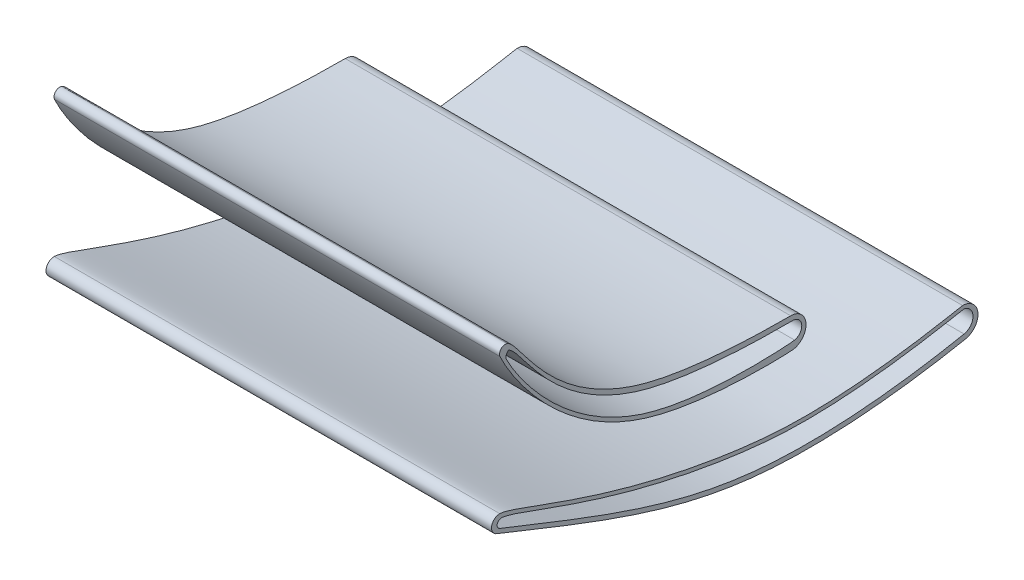
from build123d import *

# Parameters (mm, degrees)
BOSS_EXTRUDE1_DEPTH = 10
BOSS_EXTRUDE3_DEPTH = 500
SPLIT1_DEPTH        = 10
CUT_EXTRUDE4_DEPTH  = 815.609824939


# Read off the part's stored shape, not the designer's step: Split1
with BuildPart() as part:
    # Sketch1 → Boss-Extrude1 (new body)
    with BuildSketch(Plane(origin=(0, 0, 0), x_dir=(0, 0, -1), z_dir=(1, 0, 0))):
        with BuildLine():
            Line((0, -14.281480067), (0, -294.281480067))
            ThreePointArc((0, -294.281480067), (8.786796564, -315.494683503), (30, -324.281480067))
            Line((30, -324.281480067), (573.815572472, -324.281480067))
            ThreePointArc((573.815572472, -324.281480067), (580.886640283, -321.352547879), (583.815572472, -314.281480067))
            Line((583.815572472, -314.281480067), (583.815572472, -219.493566063))
            ThreePointArc((583.815572472, -219.493566063), (582.007092914, -213.757801699), (577.235773905, -210.096639855))
            Line((577.235773905, -210.096639855), (13.420201433, -4.88455386))
            ThreePointArc((13.420201433, -4.88455386), (4.264235636, -6.089959625), (0, -14.281480067))
        make_face()
    extrude(amount=BOSS_EXTRUDE1_DEPTH)

    # Sketch2 → Boss-Extrude3 (add)
    with BuildSketch(Plane(origin=(10, 0, 0), x_dir=(0, 0, -1), z_dir=(1, 0, 0))):
        with BuildLine():
            ThreePointArc((23.162175785, -218.017297737), (17.576945532, -207.678107035), (26.738120061, -200.318314743))
            add(Edge.make_bspline(
                [(26.738120061, -200.318314743), (45.914354434, -200.660753587), (151.32107334, -255.510398156), (414.880335601, -286.385074175), (542.431128002, -257.731725159), (546.154906269, -257.731029979)],
                knots=[0, 0, 0, 0, 0.560935224, 0.660935224, 1, 1, 1, 1], degree=3))
            ThreePointArc((546.154906269, -257.731029979), (563.288388976, -273.27487263), (549.474047026, -291.831036849))
            add(Edge.make_bspline(
                [(23.162175785, -218.017297737), (143.080818041, -266.034178467), (284.669923623, -324.572171749), (474.750080899, -306.502271197), (549.474047026, -291.831036849)],
                knots=[0, 0, 0, 0, 0.576111686, 1, 1, 1, 1], degree=3))
        make_face()
        with BuildLine():
            ThreePointArc((26.950185671, -47.737214996), (28.17113687, -40.715672082), (35.124917897, -39.154353359))
            add(Edge.make_bspline(
                [(35.124917897, -39.154353359), (50.602952828, -45.122445935), (99.042539, -170.661871263), (331.224003862, -171.181746235), (353.169530365, -171.181734297)],
                knots=[0, 0, 0, 0, 0.639195597, 1, 1, 1, 1], degree=3))
            ThreePointArc((353.169530365, -171.181734297), (370.309371751, -186.812434708), (356.32010769, -205.316311305))
            add(Edge.make_bspline(
                [(26.950185671, -47.737214996), (35.312726243, -66.629555086), (121.396454164, -217.989087479), (352.838937223, -205.964445921), (356.32010769, -205.316311305)],
                knots=[0, 0, 0, 0, 0.59031533, 1, 1, 1, 1], degree=3))
        make_face()
    extrude(amount=BOSS_EXTRUDE3_DEPTH)

    # Split1 outline → Split1 (cut)
    with BuildSketch(Plane.YZ):
        with BuildLine():
            ThreePointArc((-294.281480067, 0), (-315.494683503, -8.786796564), (-324.281480067, -30))
            Line((-324.281480067, -30), (-324.281480067, -573.815572472))
            ThreePointArc((-324.281480067, -573.815572472), (-321.352547879, -580.886640284), (-314.281480067, -583.815572472))
            Line((-314.281480067, -583.815572472), (-219.493566063, -583.815572472))
            ThreePointArc((-219.493566063, -583.815572472), (-213.7578017, -582.007092914), (-210.096639855, -577.235773905))
            Line((-210.096639855, -577.235773905), (-4.88455386, -13.420201433))
            ThreePointArc((-4.88455386, -13.420201433), (-6.089959625, -4.264235637), (-14.281480067, 0))
            Line((-14.281480067, 0), (-294.281480067, 0))
        make_face()
    extrude(amount=SPLIT1_DEPTH, mode=Mode.SUBTRACT)

    # Sketch4 → Cut-Extrude4 (cut, through all)
    with BuildSketch(Plane(origin=(510, 0, 0), x_dir=(0, 0, -1), z_dir=(1, 0, 0))):
        with BuildLine():
            ThreePointArc((36.563368255, -46.349264869), (33.864766991, -49.821146991), (34.206527229, -54.205165034))
            add(Edge.make_bspline(
                [(34.206527229, -54.205165034), (42.853728256, -72.241323292), (130.60126666, -216.180799122), (354.210920858, -197.746703186), (357.560551344, -197.017263718)],
                knots=[0, 0, 0, 0, 0.59031533, 1, 1, 1, 1], degree=3))
            ThreePointArc((357.560551344, -197.017263718), (365.49715028, -185.900768208), (355.211383297, -176.91360666))
            add(Edge.make_bspline(
                [(355.211383297, -176.91360666), (333.266088603, -177.014474156), (101.084686466, -177.561646331), (52.068667432, -52.246161661), (36.563368255, -46.349264869)],
                knots=[0, 0, 0, 0, 0.360804403, 1, 1, 1, 1], degree=3))
        make_face()
        with BuildLine():
            ThreePointArc((28.631678276, -205.319570052), (23.759562286, -209.371755875), (27.033044981, -214.797807405))
            add(Edge.make_bspline(
                [(27.033044981, -214.797807405), (145.772718684, -261.916580998), (285.975450577, -319.373780693), (473.898492503, -300.921699774), (547.751286849, -286.183901532)],
                knots=[0, 0, 0, 0, 0.576111686, 1, 1, 1, 1], degree=3))
            ThreePointArc((547.751286849, -286.183901532), (557.749935034, -273.992815704), (547.751286849, -261.801729876))
            add(Edge.make_bspline(
                [(547.751286849, -261.801729876), (544.030343063, -261.808782649), (416.625523479, -290.658115415), (153.214077759, -260.256942022), (47.793906807, -205.629006111), (28.631678276, -205.319570052)],
                knots=[0, 0, 0, 0, 0.339064776, 0.439064776, 1, 1, 1, 1], degree=3))
        make_face()
    extrude(amount=-CUT_EXTRUDE4_DEPTH, mode=Mode.SUBTRACT)


solid = part.part
